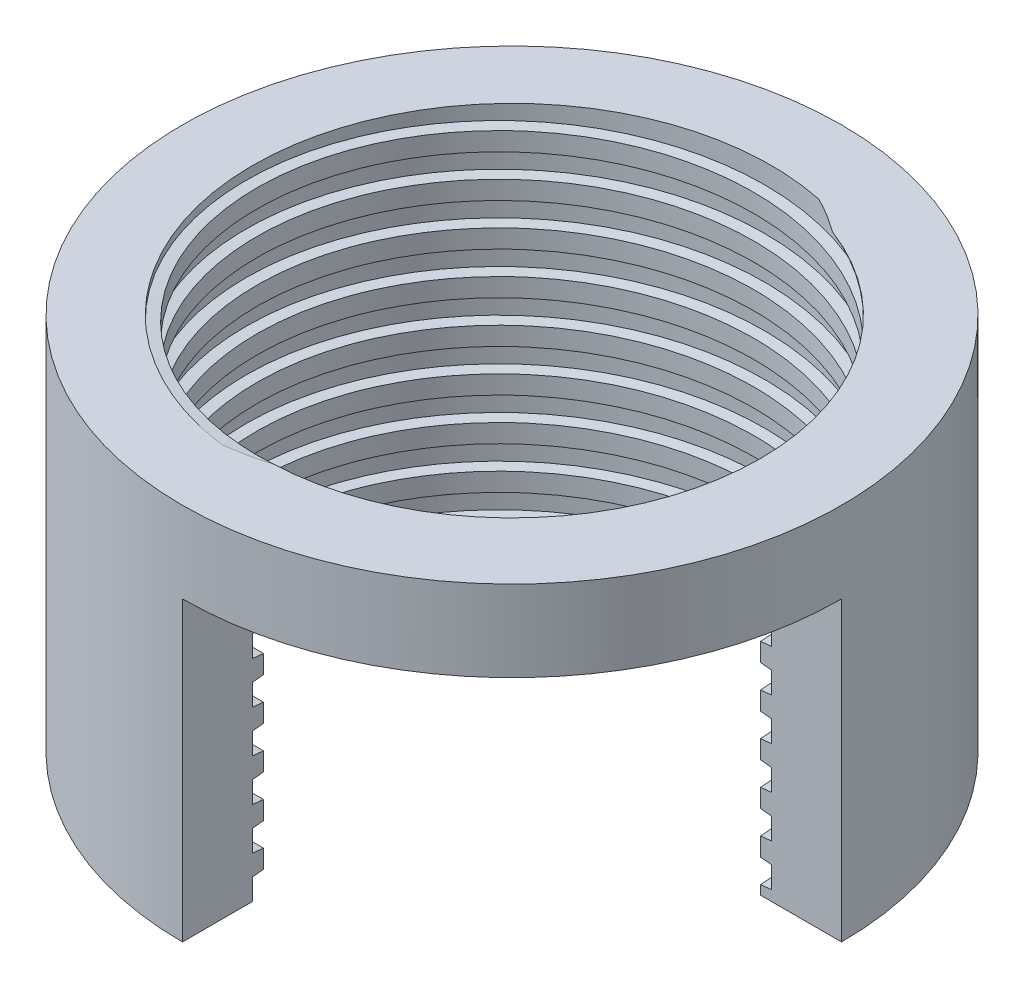
from build123d import *

# Parameters (mm, degrees)
SKETCH2_R           = 6.1
SKETCH2_R_2         = 4.6
BOSS_EXTRUDE1_DEPTH = 7
CUT_SWEEP1_PITCH    = 0.78
CUTOUT_DEPTH        = 5.5


with BuildPart() as part:
    # Sketch2 → Boss-Extrude1 (new body)
    with BuildSketch(Plane(origin=(0, 0, 0), x_dir=(1, 0, 0), z_dir=(0, 1, 0))):
        with Locations(Location((0, 0, 0), (0, 0, 270))):
            Circle(SKETCH2_R)
        with Locations(Location((0, 0, 0), (0, 0, 270))):
            Circle(SKETCH2_R_2, mode=Mode.SUBTRACT)
    extrude(amount=BOSS_EXTRUDE1_DEPTH)

    # Cut-Sweep1: arcs per turn and ends read off the stored shape
    # Cut-Sweep1: the profile of Sketch3 profile screwed along a right-hand helix through 10.5 turns, 8 arcs to a turn; built about Z, then put on its axis
    cut_sweep1_z = Axis((0, 0, 0), (0, 0, 1))
    cut_sweep1_corners = [(4.8, 0, -0.98), (4.8, 0, -0.58), (4.5997, 0, -0.55997), (4.5997, 0, -1.00003)]
    with BuildLine(mode=Mode.PRIVATE) as cut_sweep1_profile:
        Line(cut_sweep1_corners[0], cut_sweep1_corners[1])
        Line(cut_sweep1_corners[1], cut_sweep1_corners[2])
        Line(cut_sweep1_corners[2], cut_sweep1_corners[3])
        Line(cut_sweep1_corners[3], cut_sweep1_corners[0])
    cut_sweep1_cap = Face(cut_sweep1_profile.wire())
    cut_sweep1_turn_angles = [0, 22.5, 45, 67.5, 90, 112.5, 135, 157.5, 180, 202.5, 225, 247.5, 270, 292.5, 315, 337.5, 360]
    cut_sweep1_turn_weights = [1, 0.9238795325112867, 1, 0.9238795325112867, 1, 0.9238795325112867, 1, 0.9238795325112867, 1, 0.9238795325112867, 1, 0.9238795325112867, 1, 0.9238795325112867, 1, 0.9238795325112867, 1]
    cut_sweep1_turn_rails = [Edge.make_bspline([Vector(p[0], p[1], 0).rotate(cut_sweep1_z, cut_sweep1_turn_angles[k]) / cut_sweep1_turn_weights[k] + Vector(0, 0, p[2] + CUT_SWEEP1_PITCH * cut_sweep1_turn_angles[k] / 360) for k in range(17)], [0, 0, 0, 1, 1, 2, 2, 3, 3, 4, 4, 5, 5, 6, 6, 7, 7, 8, 8, 8], 2, cut_sweep1_turn_weights) for p in cut_sweep1_corners]
    cut_sweep1_turn_sides = [Face.make_surface_from_curves(cut_sweep1_turn_rails[p[0]], cut_sweep1_turn_rails[p[1]]) for p in [(0, 1), (1, 2), (2, 3), (3, 0)]]
    cut_sweep1_last_angles = [3600, 3622.5, 3645, 3667.5, 3690, 3712.5, 3735, 3757.5, 3780]
    cut_sweep1_last_weights = [1, 0.9238795325112867, 1, 0.9238795325112867, 1, 0.9238795325112867, 1, 0.9238795325112867, 1]
    cut_sweep1_last_rails = [Edge.make_bspline([Vector(p[0], p[1], 0).rotate(cut_sweep1_z, cut_sweep1_last_angles[k]) / cut_sweep1_last_weights[k] + Vector(0, 0, p[2] + CUT_SWEEP1_PITCH * cut_sweep1_last_angles[k] / 360) for k in range(9)], [0, 0, 0, 1, 1, 2, 2, 3, 3, 4, 4, 4], 2, cut_sweep1_last_weights) for p in cut_sweep1_corners]
    cut_sweep1_last_sides = [Face.make_surface_from_curves(cut_sweep1_last_rails[p[0]], cut_sweep1_last_rails[p[1]]) for p in [(0, 1), (1, 2), (2, 3), (3, 0)]]
    cut_sweep1 = Plane(origin=(0, 0, 0), x_dir=(-1, 0, 0), z_dir=(0, 1, 0)) * Solid(Shell([*[p.moved(Location((0, 0, CUT_SWEEP1_PITCH * i))) for i in range(10) for p in cut_sweep1_turn_sides], *cut_sweep1_last_sides, cut_sweep1_cap, cut_sweep1_cap.rotate(cut_sweep1_z, 3780).moved(Location((0, 0, CUT_SWEEP1_PITCH * 3780 / 360)))]))
    add(cut_sweep1, mode=Mode.SUBTRACT)

    # Sketch6 → cutout (cut)
    with BuildSketch(Plane(origin=(0, 0, 0), x_dir=(1, 0, 0), z_dir=(0, 1, 0))):
        with BuildLine():
            Line((0, 0), (7, 0))
            ThreePointArc((7, 0), (4.949747468, -4.949747468), (0, -7))
            Line((0, -7), (0, 0))
        make_face()
    extrude(amount=CUTOUT_DEPTH, mode=Mode.SUBTRACT)


solid = part.part
